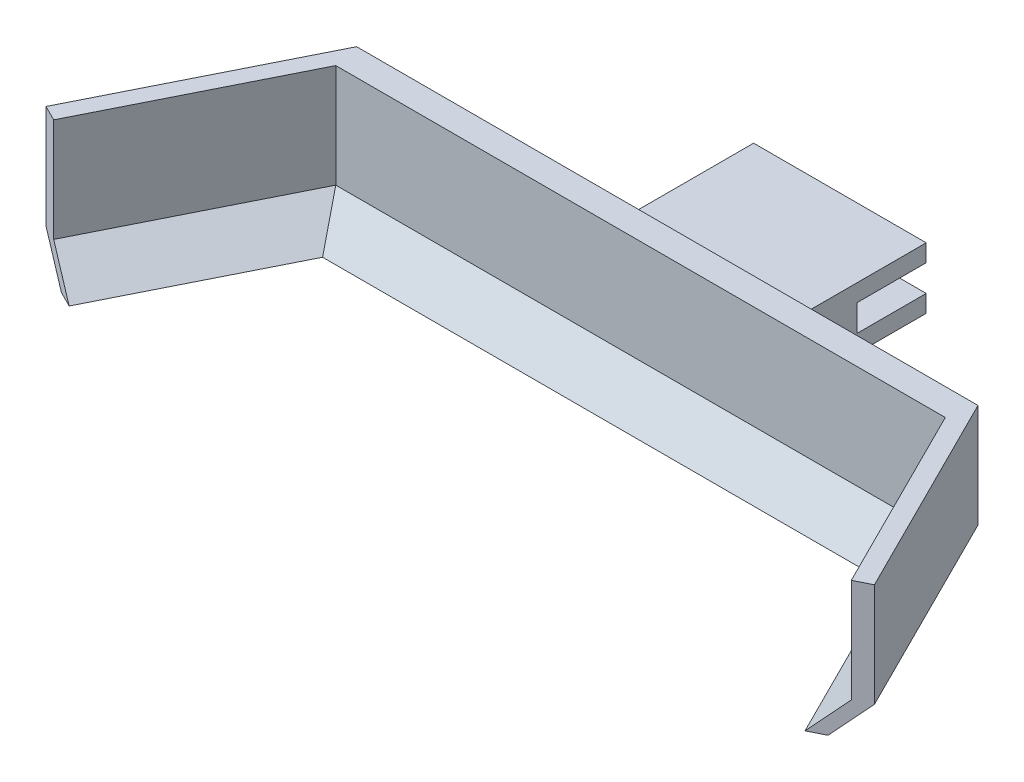
from build123d import *

# Parameters (mm, degrees)
BOSS_EXTRUDE1_DEPTH = 10
DRAFT1_ANGLE        = 45
BOSS_EXTRUDE2_DEPTH = 30
SKETCH6_W           = 50
SKETCH6_H           = 17.7
BOSS_EXTRUDE3_DEPTH = 50
SKETCH7_W           = 50
SKETCH7_H           = 7.7
CUT_EXTRUDE4_DEPTH  = 20
CHAMFER1_SIZE       = 10


with BuildPart() as part:
    # Sketch2 → Boss-Extrude1 (new body)
    with BuildSketch(Plane(origin=(0, 0, 0), x_dir=(1, 0, 0), z_dir=(0, 1, 0))):
        Polygon((-90, 5), (90, 5), (120, -55), (115.527864045, -57.236067977), (88.291796068, -2.763932023), (-88.291796068, -2.763932023), (-115.527864045, -57.236067977), (-120, -55), align=None)
    extrude(amount=BOSS_EXTRUDE1_DEPTH)

    # Draft1
    draft1_faces = [part.faces().sort_by_distance(p)[0] for p in [
        (101.909830056, 5, 30),
        (0, 5, 2.763932023),
        (-101.909830056, 5, 30),
    ]]
    draft(draft1_faces, Plane.ZX.offset(10), DRAFT1_ANGLE)

    # Sketch5 → Boss-Extrude2 (add)
    with BuildSketch(Plane(origin=(0, 10, 0), x_dir=(1, 0, 0), z_dir=(0, 1, 0))):
        Polygon((-120, -55), (-90, 5), (90, 5), (120, -55), (115.527864045, -57.236067977), (88.291796068, -2.763932023), (-88.291796068, -2.763932023), (-115.527864045, -57.236067977), align=None)
    extrude(amount=BOSS_EXTRUDE2_DEPTH)

    # Sketch6 → Boss-Extrude3 (add)
    with BuildSketch(Plane(origin=(0, 0, -5), x_dir=(-1, 0, 0), z_dir=(0, 0, -1))):
        with Locations((0, 14.45)):
            Rectangle(SKETCH6_W, SKETCH6_H)
    extrude(amount=BOSS_EXTRUDE3_DEPTH)

    # Sketch7 → Cut-Extrude4 (cut)
    with BuildSketch(Plane(origin=(0, 0, -55), x_dir=(-1, 0, 0), z_dir=(0, 0, -1))):
        with Locations((0, 14.45)):
            Rectangle(SKETCH7_W, SKETCH7_H)
    extrude(amount=-CUT_EXTRUDE4_DEPTH, mode=Mode.SUBTRACT)

    # Chamfer1
    # the kernel refuses this chamfer: 10 mm, written as the material it takes off along each edge
    with BuildSketch(Plane(origin=(78.499084045, 0, -28.001831911), x_dir=(-0.8940890232049223, -0.027495876610586386, 0.44704451160246145), z_dir=(0.44721359549995815, 0, 0.8944271909999159))) as chamfer1_piece_1:
        Polygon((CHAMFER1_SIZE * 0.999621916911, -CHAMFER1_SIZE * 0.0274958766106), (-CHAMFER1_SIZE * 0.0274958766106, -CHAMFER1_SIZE * 0.999621916911), (0, 0), align=None)
    extrude(amount=118.515699084, mode=Mode.SUBTRACT)
    with BuildSketch(Plane(origin=(-115.71682988, 0, -5), x_dir=(0, 0.9996219169112968, -0.027495876610586403), z_dir=(1, 0, 0))) as chamfer1_piece_2_section:
        Polygon((CHAMFER1_SIZE * 0.999621916911, CHAMFER1_SIZE * 0.0274958766106), (-CHAMFER1_SIZE * 0.0274958766106, CHAMFER1_SIZE * 0.999621916911), (0, 0), align=None)
    chamfer1_piece_2 = extrude(amount=231.433659759, mode=Mode.PRIVATE)
    chamfer1_piece_2 = split(chamfer1_piece_2, bisect_by=Plane(origin=(-70.35841494, 5.6, -3.753576162), z_dir=(0, 1, 0)), keep=Keep.TOP, mode=Mode.PRIVATE)
    chamfer1_piece_2 = split(chamfer1_piece_2, bisect_by=Plane(origin=(-25, 7.219915687, -3.753576162), z_dir=(-1, 0, 0)), keep=Keep.TOP, mode=Mode.PRIVATE)
    add(chamfer1_piece_2, mode=Mode.SUBTRACT)
    with BuildSketch(Plane(origin=(-115.71682988, 0, -5), x_dir=(0, 0.9996219169112968, -0.027495876610586403), z_dir=(1, 0, 0))) as chamfer1_piece_3_section:
        Polygon((CHAMFER1_SIZE * 0.999621916911, CHAMFER1_SIZE * 0.0274958766106), (-CHAMFER1_SIZE * 0.0274958766106, CHAMFER1_SIZE * 0.999621916911), (0, 0), align=None)
    chamfer1_piece_3 = extrude(amount=231.433659759, mode=Mode.PRIVATE)
    chamfer1_piece_3 = split(chamfer1_piece_3, bisect_by=Plane(origin=(-70.35841494, 5.6, -1.178972158), z_dir=(0, -1, 0)), keep=Keep.TOP, mode=Mode.PRIVATE)
    chamfer1_piece_3 = split(chamfer1_piece_3, bisect_by=Plane(origin=(-25, 2.297915816, -1.178972158), z_dir=(-1, 0, 0)), keep=Keep.TOP, mode=Mode.PRIVATE)
    add(chamfer1_piece_3, mode=Mode.SUBTRACT)
    with BuildSketch(Plane(origin=(-115.71682988, 0, -5), x_dir=(0, 0.9996219169112968, -0.027495876610586403), z_dir=(1, 0, 0))) as chamfer1_piece_4_section:
        Polygon((CHAMFER1_SIZE * 0.999621916911, CHAMFER1_SIZE * 0.0274958766106), (-CHAMFER1_SIZE * 0.0274958766106, CHAMFER1_SIZE * 0.999621916911), (0, 0), align=None)
    chamfer1_piece_4 = extrude(amount=231.433659759, mode=Mode.PRIVATE)
    chamfer1_piece_4 = split(chamfer1_piece_4, bisect_by=Plane(origin=(0, 5.6, -1.178972158), z_dir=(0, -1, 0)), keep=Keep.TOP, mode=Mode.PRIVATE)
    chamfer1_piece_4 = split(chamfer1_piece_4, bisect_by=Plane(origin=(-25, 2.297915816, -1.178972158), z_dir=(1, 0, 0)), keep=Keep.TOP, mode=Mode.PRIVATE)
    chamfer1_piece_4 = split(chamfer1_piece_4, bisect_by=Plane(origin=(25, 2.297915816, -1.178972158), z_dir=(-1, 0, 0)), keep=Keep.TOP, mode=Mode.PRIVATE)
    add(chamfer1_piece_4, mode=Mode.SUBTRACT)
    with BuildSketch(Plane(origin=(-115.71682988, 0, -5), x_dir=(0, 0.9996219169112968, -0.027495876610586403), z_dir=(1, 0, 0))) as chamfer1_piece_5_section:
        Polygon((CHAMFER1_SIZE * 0.999621916911, CHAMFER1_SIZE * 0.0274958766106), (-CHAMFER1_SIZE * 0.0274958766106, CHAMFER1_SIZE * 0.999621916911), (0, 0), align=None)
    chamfer1_piece_5 = extrude(amount=231.433659759, mode=Mode.PRIVATE)
    chamfer1_piece_5 = split(chamfer1_piece_5, bisect_by=Plane(origin=(70.35841494, 5.6, -3.753576162), z_dir=(0, 1, 0)), keep=Keep.TOP, mode=Mode.PRIVATE)
    chamfer1_piece_5 = split(chamfer1_piece_5, bisect_by=Plane(origin=(25, 7.219915687, -3.753576162), z_dir=(1, 0, 0)), keep=Keep.TOP, mode=Mode.PRIVATE)
    add(chamfer1_piece_5, mode=Mode.SUBTRACT)
    with BuildSketch(Plane(origin=(-115.71682988, 0, -5), x_dir=(0, 0.9996219169112968, -0.027495876610586403), z_dir=(1, 0, 0))) as chamfer1_piece_6_section:
        Polygon((CHAMFER1_SIZE * 0.999621916911, CHAMFER1_SIZE * 0.0274958766106), (-CHAMFER1_SIZE * 0.0274958766106, CHAMFER1_SIZE * 0.999621916911), (0, 0), align=None)
    chamfer1_piece_6 = extrude(amount=231.433659759, mode=Mode.PRIVATE)
    chamfer1_piece_6 = split(chamfer1_piece_6, bisect_by=Plane(origin=(70.35841494, 5.6, -1.178972158), z_dir=(0, -1, 0)), keep=Keep.TOP, mode=Mode.PRIVATE)
    chamfer1_piece_6 = split(chamfer1_piece_6, bisect_by=Plane(origin=(25, 2.297915816, -1.178972158), z_dir=(1, 0, 0)), keep=Keep.TOP, mode=Mode.PRIVATE)
    add(chamfer1_piece_6, mode=Mode.SUBTRACT)
    with BuildSketch(Plane(origin=(-131.500915955, 0, 78.001831911), x_dir=(-0.02459305968088589, 0.9996219169112968, -0.012296529840442941), z_dir=(0.447213595499958, 0, -0.894427190999916))) as chamfer1_piece_7:
        Polygon((CHAMFER1_SIZE * 0.999621916911, CHAMFER1_SIZE * 0.0274958766106), (-CHAMFER1_SIZE * 0.0274958766106, CHAMFER1_SIZE * 0.999621916911), (0, 0), align=None)
    extrude(amount=118.515699084, mode=Mode.SUBTRACT)


solid = part.part
